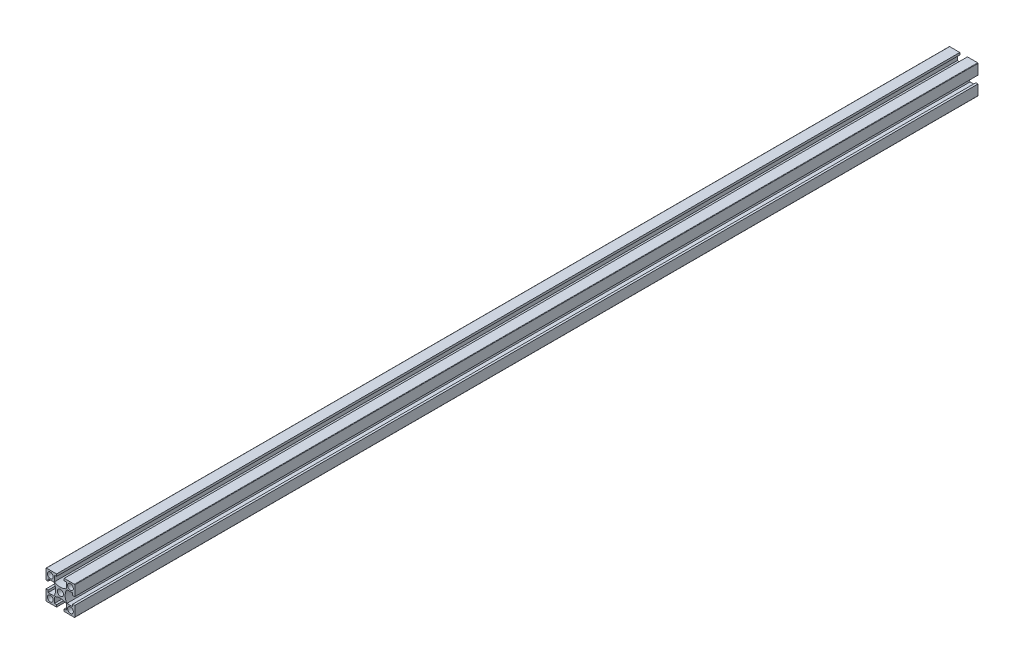
from build123d import *

# Parameters (mm, degrees)
SKETCH_1_W               = 20
SKETCH_1_H               = 20
SKETCH_1_R               = 2
SKETCH_1_R_2             = 2.15
EXTRUDE_1_DEPTH          = 628
CUT_EXTRUDE_1_REACH      = 630.159
PATTERN_CIRCULAR_1_COUNT = 4
FILLET_1_R               = 0.3
CUT_EXTRUDE_2_DEPTH      = 629.159215486
CUT_EXTRUDE_2_DEPTH_BACK = 629.159215486
SKETCH_2_R               = 2.5


with BuildPart() as part:
    # 스케치1 → 보스-돌출1 (new body)
    with BuildSketch(Plane.XY):
        Rectangle(SKETCH_1_W, SKETCH_1_H)
        with Locations((-7, -7)):
            Circle(SKETCH_1_R, mode=Mode.SUBTRACT)
        with Locations((7, -7)):
            Circle(SKETCH_1_R, mode=Mode.SUBTRACT)
        with Locations((-7, 7)):
            Circle(SKETCH_1_R, mode=Mode.SUBTRACT)
        Circle(SKETCH_1_R_2, mode=Mode.SUBTRACT)
        with Locations((7, 7)):
            Circle(SKETCH_1_R, mode=Mode.SUBTRACT)
    extrude(amount=EXTRUDE_1_DEPTH)

    # 스케치1<3> → 컷-돌출1 (cut, up to next)
    with BuildSketch(Plane.XY, mode=Mode.PRIVATE) as cut_extrude_1_sk1:
        with BuildLine():
            Line((-8.5, 2.65), (-10, 2.65))
            Line((-10, 2.65), (-10, -2.65))
            Line((-10, -2.65), (-8.5, -2.65))
            Line((-8.5, -2.65), (-8.5, -4.15))
            Line((-8.5, -4.15), (-4.503166667, -4.15))
            ThreePointArc((-4.503166667, -4.15), (-3.3, 0), (-4.503166667, 4.15))
            Line((-4.503166667, 4.15), (-8.5, 4.15))
            Line((-8.5, 4.15), (-8.5, 2.65))
        make_face()
    cut_extrude_1_tool1 = extrude(cut_extrude_1_sk1.sketch, amount=CUT_EXTRUDE_1_REACH, mode=Mode.PRIVATE) & part.part
    cut_extrude_1 = cut_extrude_1_tool1.solids().sort_by_distance((-6.606913, 0, 0))[0]
    add(cut_extrude_1, mode=Mode.SUBTRACT)

    # 원형 패턴1: 컷-돌출1 ×4 about axis
    pattern_circular_1_axis = Axis((0, 0, 628), (0, 0, -1))
    for i in range(1, PATTERN_CIRCULAR_1_COUNT):
        add(cut_extrude_1.rotate(pattern_circular_1_axis, i * 360 / PATTERN_CIRCULAR_1_COUNT), mode=Mode.SUBTRACT)

    # 필렛1
    fillet_1_edges = [part.edges().sort_by_distance(p)[0] for p in [
        (10, -10, 314),
        (-10, -10, 314),
        (-10, 10, 314),
        (10, 10, 314),
    ]]
    fillet(fillet_1_edges, radius=FILLET_1_R)

    # 스케치2 → 컷-돌출2 (cut, two sides: drawn at the far end of the back side and taken through both)
    with BuildSketch(Plane(origin=(0, 0, 0), x_dir=(0, 0, -1), z_dir=(1, 0, 0)).offset(-CUT_EXTRUDE_2_DEPTH_BACK)):
        with Locations((-15, 0)):
            Circle(SKETCH_2_R)
    extrude(amount=CUT_EXTRUDE_2_DEPTH + CUT_EXTRUDE_2_DEPTH_BACK, mode=Mode.SUBTRACT)


solid = part.part
